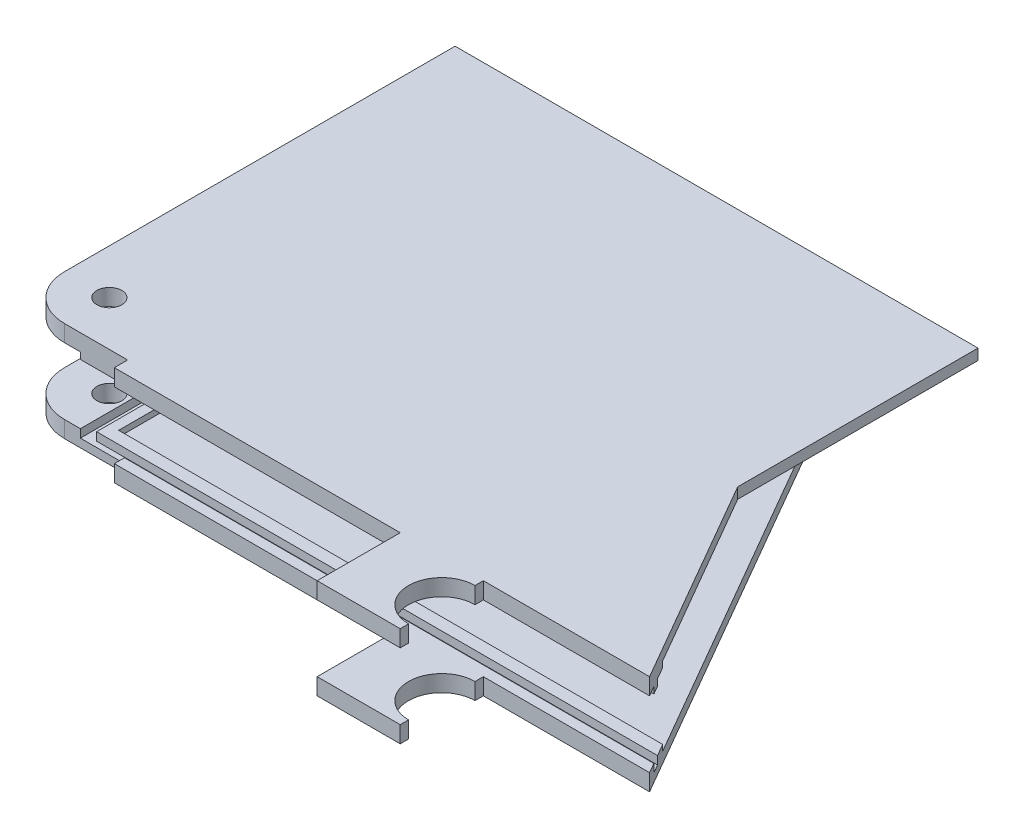
from build123d import *

# Parameters (mm, degrees)
STANDARD_START                 = 1.845946354
STANDARD_CREDIT_CARD_OUTLINE_W = 0.79375
STANDARD_CREDIT_CARD_OUTLINE_H = 53.975
STANDARD_CREDIT_CARD_DEPTH     = 85.598
MOVE_START                     = 1.845946354
MOVE_FACE1_OUTLINE_W           = 1.04775
MOVE_FACE1_OUTLINE_H           = 54.229
MOVE_FACE1_DEPTH               = 85.725
BOSS_EXTRUDE2_START            = -0.889
SKETCH1_R                      = 1.905
BOSS_EXTRUDE2_DEPTH            = 2.54
BOSS_EXTRUDE3_DEPTH            = 1
SKETCH7_W                      = 6.35
SKETCH7_H                      = 2.032
CUT_EXTRUDE2_DEPTH             = 120.262889651
CUT_EXTRUDE1_DEPTH             = 2
MOVE_START_2                   = -1.27
MOVE_FACE4_OUTLINE_W           = 0.254
MOVE_FACE4_OUTLINE_H           = 1.27
MOVE_FACE4_DEPTH               = 88.075975799
MOVE_FACE4_2_OUTLINE_W         = 0.254
MOVE_FACE4_2_OUTLINE_H         = 57.643162038
MOVE_FACE4_2_DEPTH             = 1.591946354
MOVE_START_3                   = -1.2954
MOVE_FACE5_OUTLINE_W           = 1.254
MOVE_FACE5_OUTLINE_H           = 1.3208
MOVE_FACE5_OUTLINE_H_2         = 0.0254
MOVE_FACE5_OUTLINE_H_3         = 0.836009737
MOVE_FACE5_DEPTH               = 88.116040496
MOVE_FACE5_2_OUTLINE_W         = 1.254
MOVE_FACE5_2_OUTLINE_H         = 57.592362038
MOVE_FACE5_2_DEPTH             = 1.642746354
BOSS_EXTRUDE5_DEPTH            = 1.651


# Read off the part's stored shape, not the designer's step: Standard Credit Card, Move Face1, Move Face4, Move Face5
with BuildPart() as part:
    # Standard Credit Card outline → Standard Credit Card (new body)
    with BuildSketch(Plane.YZ.offset(STANDARD_START)):
        with Locations((-56.663058778, 36.176138951)):
            Rectangle(STANDARD_CREDIT_CARD_OUTLINE_W, STANDARD_CREDIT_CARD_OUTLINE_H)
    extrude(amount=STANDARD_CREDIT_CARD_DEPTH)

    # Move Face1 outline → Move Face1 (add)
    with BuildSketch(Plane.YZ.offset(MOVE_START)):
        with Locations((-56.663058778, 36.176138951)):
            Rectangle(MOVE_FACE1_OUTLINE_W, MOVE_FACE1_OUTLINE_H)
    extrude(amount=MOVE_FACE1_DEPTH)


with BuildPart() as body_2:
    # Sketch1 → Boss-Extrude2 (new body)
    with BuildSketch(Plane(origin=(0, -56.139183778, 0), x_dir=(1, 0, 0), z_dir=(0, 1, 0)).offset(BOSS_EXTRUDE2_START)):
        with BuildLine():
            Line((35.050395743, 0.549751296), (-10.584077546, 0.549751296))
            Line((-10.584077546, 0.549751296), (-10.584077546, -59.140248704))
            ThreePointArc((-10.584077546, -59.140248704), (-8.575415852, -63.989587009), (-3.726077546, -65.998248704))
            Line((-3.726077546, -65.998248704), (-0.424077546, -65.998248704))
            Line((-0.424077546, -65.998248704), (-0.424077546, -68.030248704))
            Line((-0.424077546, -68.030248704), (49.613922454, -68.030248704))
            Line((49.613922454, -68.030248704), (49.613922454, -80.730248704))
            Line((49.613922454, -80.730248704), (62.313922454, -80.730248704))
            Line((62.313922454, -80.730248704), (62.313922454, -79.460248704))
            ThreePointArc((62.313922454, -79.460248704), (57.233922454, -74.380248704), (62.313922454, -69.300248704))
            Line((62.313922454, -69.300248704), (62.313922454, -68.030248704))
            Line((62.313922454, -68.030248704), (87.713922454, -68.030248704))
            Line((87.713922454, -68.030248704), (48.119240993, 0.549751296))
            Line((48.119240993, 0.549751296), (35.050395743, 0.549751296))
        make_face()
        with Locations(Location((-3.726077546, -59.140248704, 0), (0, 0, 270))):
            Circle(SKETCH1_R, mode=Mode.SUBTRACT)
    extrude(amount=BOSS_EXTRUDE2_DEPTH)

    # Combine1: cut part
    add(part.part, mode=Mode.SUBTRACT)

    # Sketch4 → Boss-Extrude3 (add)
    with BuildSketch(Plane(origin=(0, -57.028183778, 0), x_dir=(1, 0, 0), z_dir=(0, 1, 0))):
        Polygon((86.805975799, -66.457638967), (86.072740957, -65.187638967), (86.047441301, -65.187638967), (0.321946354, -65.187638967), (0.321946354, -7.544476929), (52.792445837, -7.544476929), (52.059210995, -6.274476929), (-1.27, -6.274476929), (-1.27, -65.998248704), (-0.424077546, -65.998248704), (-0.424077546, -66.457638967), align=None)
    extrude(amount=-BOSS_EXTRUDE3_DEPTH)

    # Sketch7 → Cut-Extrude2 (cut, through all)
    with BuildSketch(Plane.XZ.offset(58.028183778)):
        with Locations((2.750922454, 67.014248704)):
            Rectangle(SKETCH7_W, SKETCH7_H)
    extrude(amount=-CUT_EXTRUDE2_DEPTH, mode=Mode.SUBTRACT)


with BuildPart() as body_2_2:
    # Mirror1: mirrored copy
    add(body_2.part.mirror(Plane(origin=(-3.726077546, -57.028183778, 59.140248704), x_dir=(0, 0, 1), z_dir=(0, 1, 0))))

    # Sketch5 → Cut-Extrude1 (cut)
    with BuildSketch(Plane(origin=(0, -56.028183778, 0), x_dir=(1, 0, 0), z_dir=(0, 1, 0))):
        Polygon((86.072740957, -65.187638967), (1.357962756, -65.187638967), (0.321946354, -65.187638967), (0.321946354, -63.9570649), (0.321946354, -7.544476929), (52.792445837, -7.544476929), (52.059210995, -6.274476929), (-1.27, -6.274476929), (-1.27, -63.9570649), (-1.27, -65.998248704), (-0.424077546, -65.998248704), (-0.424077546, -66.457638967), (1.357962756, -66.457638967), (86.805975799, -66.457638967), align=None)
    extrude(amount=-CUT_EXTRUDE1_DEPTH, mode=Mode.SUBTRACT)

    # Move Face4 outline → Move Face4 (cut)
    with BuildSketch(Plane.YZ.offset(MOVE_START_2)):
        with Locations((-58.155183778, 6.909476929)):
            Rectangle(MOVE_FACE4_OUTLINE_W, MOVE_FACE4_OUTLINE_H)
        with Locations((-58.155183778, 65.822638967)):
            Rectangle(MOVE_FACE4_OUTLINE_W, MOVE_FACE4_OUTLINE_H)
    extrude(amount=MOVE_FACE4_DEPTH, mode=Mode.SUBTRACT)

    # Move Face4 2 outline → Move Face4 2 (cut)
    with BuildSketch(Plane.YZ.offset(MOVE_START_2)):
        with Locations((-58.155183778, 36.366057948)):
            Rectangle(MOVE_FACE4_2_OUTLINE_W, MOVE_FACE4_2_OUTLINE_H)
    extrude(amount=MOVE_FACE4_2_DEPTH, mode=Mode.SUBTRACT)

    # Move Face5 outline → Move Face5 (cut)
    with BuildSketch(Plane.YZ.offset(MOVE_START_3)):
        with Locations((-57.655183778, 6.909476929)):
            Rectangle(MOVE_FACE5_OUTLINE_W, MOVE_FACE5_OUTLINE_H)
        with Locations((-57.655183778, 66.470338967)):
            Rectangle(MOVE_FACE5_OUTLINE_W, MOVE_FACE5_OUTLINE_H_2)
        with Locations((-57.655183778, 65.580243835)):
            Rectangle(MOVE_FACE5_OUTLINE_W, MOVE_FACE5_OUTLINE_H_3)
    extrude(amount=MOVE_FACE5_DEPTH, mode=Mode.SUBTRACT)

    # Move Face5 2 outline → Move Face5 2 (cut)
    with BuildSketch(Plane.YZ.offset(MOVE_START_3)):
        with Locations((-57.655183778, 36.366057948)):
            Rectangle(MOVE_FACE5_2_OUTLINE_W, MOVE_FACE5_2_OUTLINE_H)
    extrude(amount=MOVE_FACE5_2_DEPTH, mode=Mode.SUBTRACT)


with BuildPart() as body_2_1:
    # Body-Move/Copy1: moved
    add(body_2.part.moved(Location((0, 10.16, 0))))

    # Sketch8 → Boss-Extrude5 (add)
    with BuildSketch(Plane.XZ.offset(44.328183778)):
        Polygon((48.119240993, -0.549751296), (69.322943613, -0.549751296), (69.322943613, 36.176138951), align=None)
    extrude(amount=BOSS_EXTRUDE5_DEPTH)


solid = Compound([body_2_2.part, body_2_1.part])
